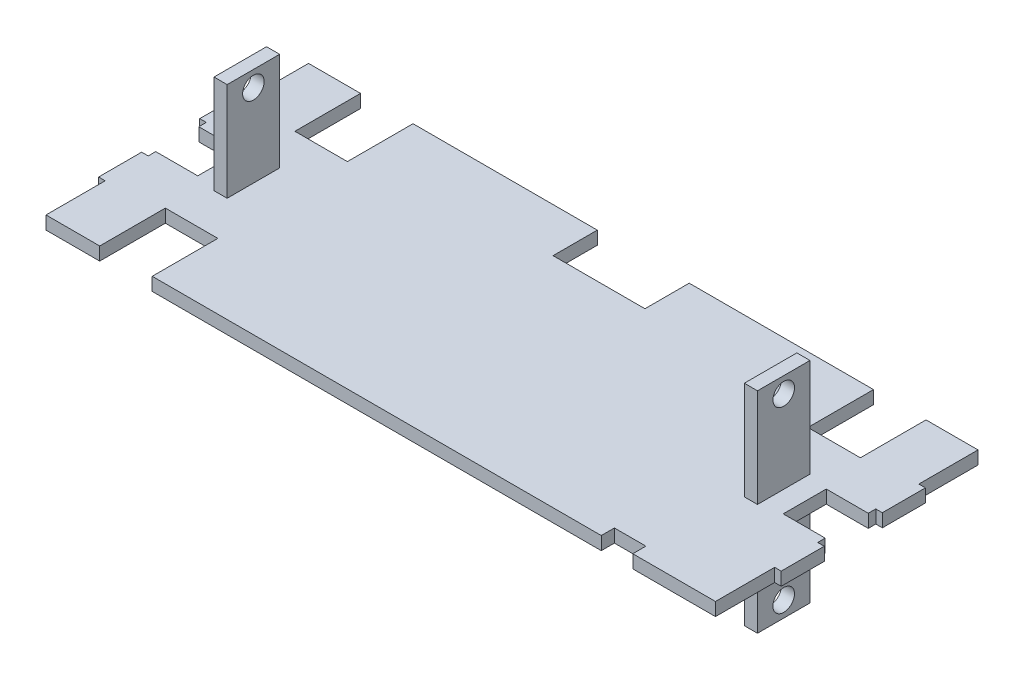
from build123d import *

# Parameters (mm, degrees)
BOSS_EXTRUDE1_DEPTH     = 3.175
SKETCH2_W               = 6.35
SKETCH2_H               = 25.4
BOSS_EXTRUDE2_DEPTH     = 50.8
CUT_EXTRUDE1_DEPTH      = 308.492808087
CUT_EXTRUDE1_DEPTH_BACK = 308.492808087
SKETCH3_R               = 5.207


with BuildPart() as part:
    # Sketch1 → Boss-Extrude1 (new, symmetric)
    with BuildSketch(Plane(origin=(0, 0, 0), x_dir=(1, 0, 0), z_dir=(0, 1, 0))):
        Polygon((161.925, -63.5), (121.92, -63.5), (121.92, -57.15), (106.68, -57.15), (106.68, -63.5), (-106.68, -63.5), (-110.5408, -63.5), (-110.5408, -31.75), (-135.9408, -31.75), (-135.9408, -63.5), (-161.925, -63.5), (-161.925, -34.874677354), (-165.1, -34.874677354), (-165.1, -14.046677354), (-161.925, -14.046677354), (-161.925, -10.414), (-141.605, -10.414), (-141.605, 10.414), (-161.925, 10.414), (-161.925, 14.046677354), (-165.1, 14.046677354), (-165.1, 34.874677354), (-161.925, 34.874677354), (-161.925, 63.5), (-136.779, 63.5), (-136.779, 31.75), (-111.379, 31.75), (-111.379, 63.5), (-22.228595254, 63.5), (-22.228595254, 42.086140348), (22.228595254, 42.086140348), (22.228595254, 63.5), (111.379, 63.5), (111.379, 31.75), (136.779, 31.75), (136.779, 63.5), (161.925, 63.5), (161.925, 34.874677354), (165.1, 34.874677354), (165.1, 14.046677354), (161.925, 14.046677354), (161.925, 10.414), (141.605, 10.414), (141.605, -10.414), (161.925, -10.414), (161.925, -14.046677354), (165.1, -14.046677354), (165.1, -34.874677354), (161.925, -34.874677354), align=None)
    extrude(amount=BOSS_EXTRUDE1_DEPTH, both=True)

    # Sketch2 → Boss-Extrude2 (add, symmetric)
    with BuildSketch(Plane(origin=(0, 0, 0), x_dir=(1, 0, 0), z_dir=(0, 1, 0))):
        with Locations((128.27, 0)):
            Rectangle(SKETCH2_W, SKETCH2_H)
        with Locations((-128.27, 0)):
            Rectangle(SKETCH2_W, SKETCH2_H)
    extrude(amount=BOSS_EXTRUDE2_DEPTH, both=True)

    # Sketch3 → Cut-Extrude1 (cut, two sides: drawn at the far end of the back side and taken through both)
    with BuildSketch(Plane.ZY.offset(131.445).offset(-CUT_EXTRUDE1_DEPTH_BACK)):
        with Locations((0, 43.18)):
            Circle(SKETCH3_R)
        with Locations((0, -43.18)):
            Circle(SKETCH3_R)
    extrude(amount=CUT_EXTRUDE1_DEPTH + CUT_EXTRUDE1_DEPTH_BACK, mode=Mode.SUBTRACT)


solid = part.part
